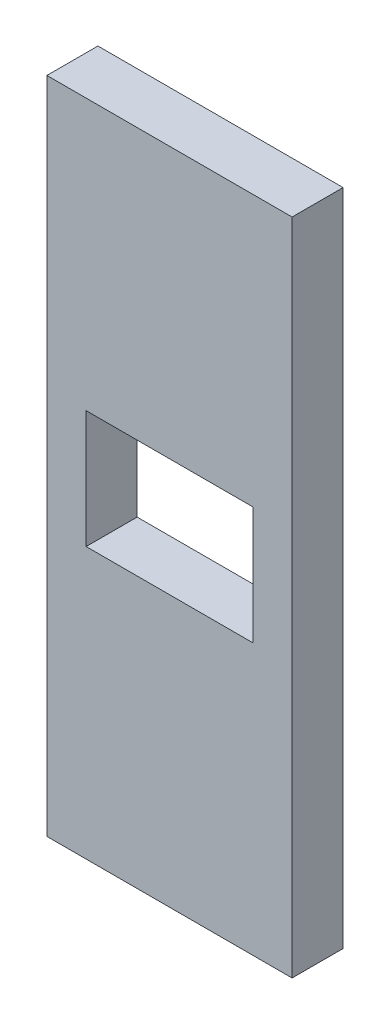
from build123d import *

# Parameters (mm, degrees)
SKETCH1_W           = 17
SKETCH1_H           = 12
BOSS_EXTRUDE1_DEPTH = 5.2


with BuildPart() as part:
    # Sketch1 → Boss-Extrude1 (new body)
    with BuildSketch(Plane.XY):
        Polygon((0, 67.2), (0, 44.8), (0, 39.6), (0, 27.6), (0, 22.4), (0, 0), (25, 0), (25, 22.4), (25, 27.6), (25, 39.6), (25, 44.8), (25, 67.2), align=None)
        with Locations((12.5, 33.6)):
            Rectangle(SKETCH1_W, SKETCH1_H, mode=Mode.SUBTRACT)
    extrude(amount=BOSS_EXTRUDE1_DEPTH)


solid = part.part
